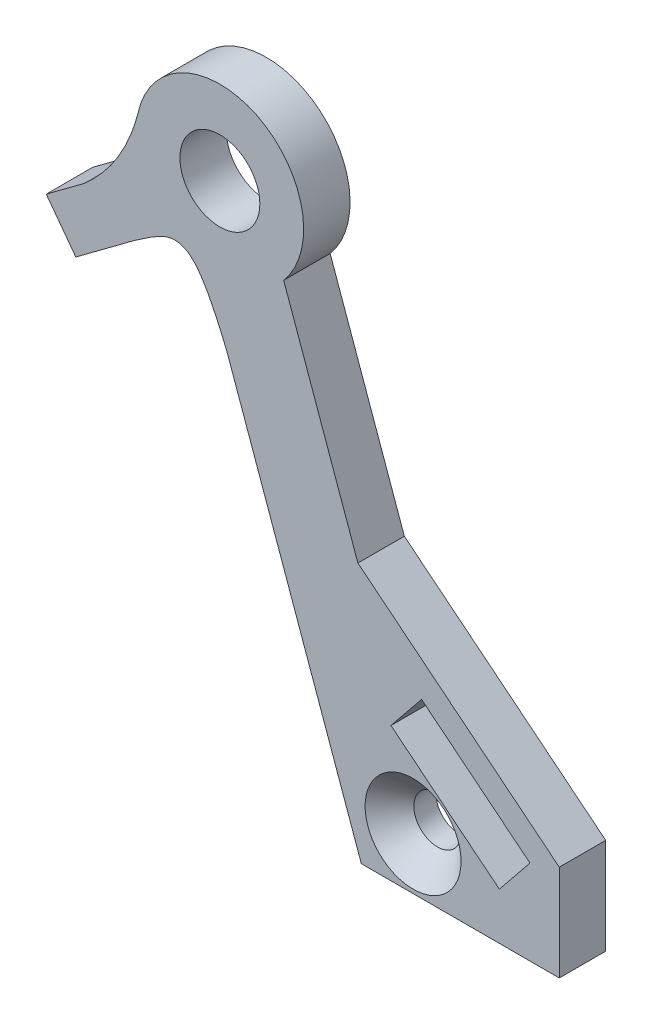
from build123d import *

# Parameters (mm, degrees)
SKETCH1_R           = 1.5
SKETCH1_R_2         = 2.625
BOSS_EXTRUDE1_DEPTH = 3.05


with BuildPart() as part:
    # Sketch1 → Boss-Extrude1 (new body)
    with BuildSketch(Plane.XY):
        with BuildLine():
            Line((-8.803360363, 24.654236343), (0, 0))
            Line((0, 0), (13, 0))
            Line((13, 0), (13, 6.303908615))
            Line((13, 6.303908615), (-0.225000063, 16.985639436))
            Line((-0.225000063, 16.985639436), (-5.096612315, 30.628825091))
            ThreePointArc((-5.096612315, 30.628825091), (-6.864545193, 39.127004069), (-14.669149283, 35.327953187))
            add(Edge.make_bspline(
                [(-18.236074249, 29.557782775), (-15.56964568, 31.860427367), (-14.669149283, 35.327953187)],
                knots=[0, 0, 0, 1, 1, 1], degree=2))
            Line((-18.236074249, 29.557782775), (-20.68803125, 27.733458745))
            Line((-20.68803125, 27.733458745), (-18.748011912, 25.126003095))
            Line((-18.748011912, 25.126003095), (-14.872658256, 28.009373723))
            add(Edge.make_bspline(
                [(-14.872658256, 28.009373723), (-13.321413482, 29.087354752), (-12.034218378, 29.87005609), (-10.324464656, 28.408317489), (-8.803360363, 24.654236343)],
                knots=[0, 0, 0, 0, 0.517103648, 1, 1, 1, 1], degree=3))
        make_face()
        with Locations((3.4, 3.4)):
            Circle(SKETCH1_R, mode=Mode.SUBTRACT)
        Polygon((11.073847559, 5.572751724), (9.110294099, 3.141685535), (9.063168816, 3.083339947), (1.945007017, 8.832624477), (3.95568576, 11.322036253), align=None, mode=Mode.SUBTRACT)
        with Locations((-9.28819898, 34.189808273)):
            Circle(SKETCH1_R_2, mode=Mode.SUBTRACT)
    extrude(amount=BOSS_EXTRUDE1_DEPTH)

    # Sketch3 → CSK for M3 Flat Head Machine Screw1 (revolve, cut)
    with BuildSketch(Plane(origin=(3.4, 3.4, 3.05), x_dir=(0, -1, 0), z_dir=(1, 0, 0))):
        Polygon((0, 0), (0, 3.05), (1.55, 3.05), (1.55, 1.6), (3.15, 0), align=None)
    revolve(axis=Axis((3.4, 3.4, 9.4), (0, 0, -1)), mode=Mode.SUBTRACT)


solid = part.part
